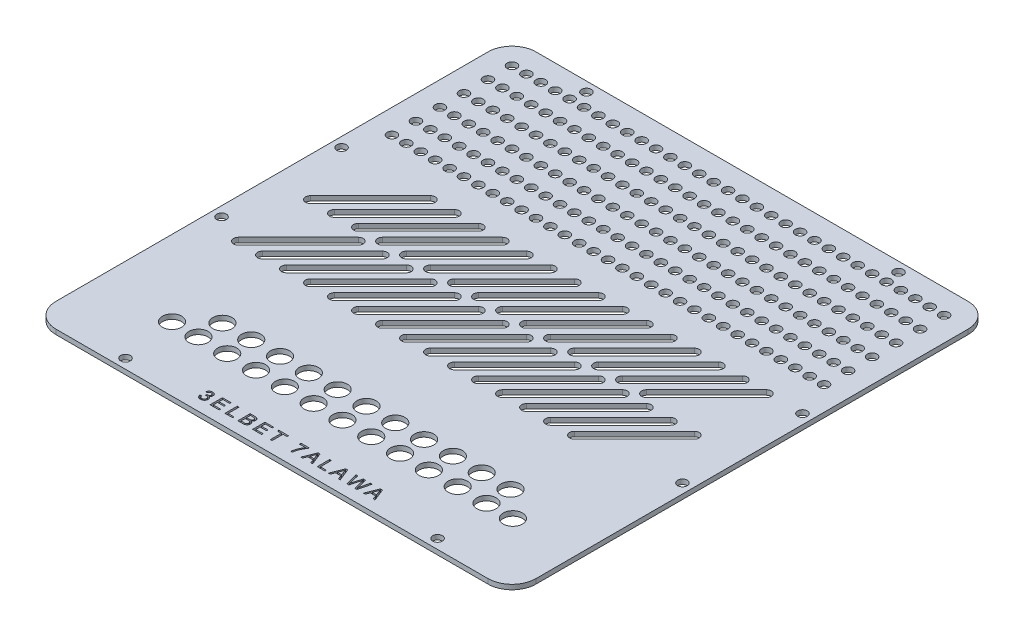
from build123d import *

# Parameters (mm, degrees)
SKETCH2_R             = 2
SKETCH2_R_2           = 4
BOSS_EXTRUDE2_DEPTH   = 2
BOSS_EXTRUDE2_2_DEPTH = 2
BOSS_EXTRUDE2_3_DEPTH = 2
BOSS_EXTRUDE2_4_DEPTH = 2
BOSS_EXTRUDE2_5_DEPTH = 2
BOSS_EXTRUDE2_6_DEPTH = 2


with BuildPart() as part:
    # Sketch2 → Boss-Extrude2 (new body)
    with BuildSketch(Plane(origin=(0, 0, 0), x_dir=(1, 0, 0), z_dir=(0, 1, 0))):
        with BuildLine():
            Line((-90, -100), (90, -100))
            ThreePointArc((90, -100), (97.071067812, -97.071067812), (100, -90))
            Line((100, -90), (100, 90))
            ThreePointArc((100, 90), (97.071067812, 97.071067812), (90, 100))
            Line((90, 100), (-90, 100))
            ThreePointArc((-90, 100), (-97.071067812, 97.071067812), (-100, 90))
            Line((-100, 90), (-100, -90))
            ThreePointArc((-100, -90), (-97.071067812, -97.071067812), (-90, -100))
        make_face()
        with Locations((-65, 96)):
            Circle(SKETCH2_R, mode=Mode.SUBTRACT)
        with Locations((65, 96)):
            Circle(SKETCH2_R, mode=Mode.SUBTRACT)
        with Locations((96, 25)):
            Circle(SKETCH2_R, mode=Mode.SUBTRACT)
        with Locations((96, -25)):
            Circle(SKETCH2_R, mode=Mode.SUBTRACT)
        with Locations((-96, 25)):
            Circle(SKETCH2_R, mode=Mode.SUBTRACT)
        with Locations((-96, -25)):
            Circle(SKETCH2_R, mode=Mode.SUBTRACT)
        with Locations((-65, -96)):
            Circle(SKETCH2_R, mode=Mode.SUBTRACT)
        with Locations((65, -96)):
            Circle(SKETCH2_R, mode=Mode.SUBTRACT)
        with Locations((-90, 90)):
            Circle(SKETCH2_R, mode=Mode.SUBTRACT)
        with Locations((-84, 90)):
            Circle(SKETCH2_R, mode=Mode.SUBTRACT)
        with Locations((-78, 90)):
            Circle(SKETCH2_R, mode=Mode.SUBTRACT)
        with Locations((-72, 90)):
            Circle(SKETCH2_R, mode=Mode.SUBTRACT)
        with Locations((-66, 90)):
            Circle(SKETCH2_R, mode=Mode.SUBTRACT)
        with Locations((-60, 90)):
            Circle(SKETCH2_R, mode=Mode.SUBTRACT)
        with Locations((-54, 90)):
            Circle(SKETCH2_R, mode=Mode.SUBTRACT)
        with Locations((-48, 90)):
            Circle(SKETCH2_R, mode=Mode.SUBTRACT)
        with Locations((-42, 90)):
            Circle(SKETCH2_R, mode=Mode.SUBTRACT)
        with Locations((-36, 90)):
            Circle(SKETCH2_R, mode=Mode.SUBTRACT)
        with Locations((-30, 90)):
            Circle(SKETCH2_R, mode=Mode.SUBTRACT)
        with Locations((-24, 90)):
            Circle(SKETCH2_R, mode=Mode.SUBTRACT)
        with Locations((-18, 90)):
            Circle(SKETCH2_R, mode=Mode.SUBTRACT)
        with Locations((-12, 90)):
            Circle(SKETCH2_R, mode=Mode.SUBTRACT)
        with Locations((-6, 90)):
            Circle(SKETCH2_R, mode=Mode.SUBTRACT)
        with Locations((0, 90)):
            Circle(SKETCH2_R, mode=Mode.SUBTRACT)
        with Locations((6, 90)):
            Circle(SKETCH2_R, mode=Mode.SUBTRACT)
        with Locations((12, 90)):
            Circle(SKETCH2_R, mode=Mode.SUBTRACT)
        with Locations((18, 90)):
            Circle(SKETCH2_R, mode=Mode.SUBTRACT)
        with Locations((24, 90)):
            Circle(SKETCH2_R, mode=Mode.SUBTRACT)
        with Locations((30, 90)):
            Circle(SKETCH2_R, mode=Mode.SUBTRACT)
        with Locations((36, 90)):
            Circle(SKETCH2_R, mode=Mode.SUBTRACT)
        with Locations((42, 90)):
            Circle(SKETCH2_R, mode=Mode.SUBTRACT)
        with Locations((48, 90)):
            Circle(SKETCH2_R, mode=Mode.SUBTRACT)
        with Locations((54, 90)):
            Circle(SKETCH2_R, mode=Mode.SUBTRACT)
        with Locations((60, 90)):
            Circle(SKETCH2_R, mode=Mode.SUBTRACT)
        with Locations((66, 90)):
            Circle(SKETCH2_R, mode=Mode.SUBTRACT)
        with Locations((72, 90)):
            Circle(SKETCH2_R, mode=Mode.SUBTRACT)
        with Locations((78, 90)):
            Circle(SKETCH2_R, mode=Mode.SUBTRACT)
        with Locations((84, 90)):
            Circle(SKETCH2_R, mode=Mode.SUBTRACT)
        with Locations((90, 90)):
            Circle(SKETCH2_R, mode=Mode.SUBTRACT)
        with Locations((-84, 80)):
            Circle(SKETCH2_R, mode=Mode.SUBTRACT)
        with Locations((-78, 80)):
            Circle(SKETCH2_R, mode=Mode.SUBTRACT)
        with Locations((-72, 80)):
            Circle(SKETCH2_R, mode=Mode.SUBTRACT)
        with Locations((-66, 80)):
            Circle(SKETCH2_R, mode=Mode.SUBTRACT)
        with Locations((-60, 80)):
            Circle(SKETCH2_R, mode=Mode.SUBTRACT)
        with Locations((-54, 80)):
            Circle(SKETCH2_R, mode=Mode.SUBTRACT)
        with Locations((-48, 80)):
            Circle(SKETCH2_R, mode=Mode.SUBTRACT)
        with Locations((-42, 80)):
            Circle(SKETCH2_R, mode=Mode.SUBTRACT)
        with Locations((-36, 80)):
            Circle(SKETCH2_R, mode=Mode.SUBTRACT)
        with Locations((-30, 80)):
            Circle(SKETCH2_R, mode=Mode.SUBTRACT)
        with Locations((-24, 80)):
            Circle(SKETCH2_R, mode=Mode.SUBTRACT)
        with Locations((-18, 80)):
            Circle(SKETCH2_R, mode=Mode.SUBTRACT)
        with Locations((-12, 80)):
            Circle(SKETCH2_R, mode=Mode.SUBTRACT)
        with Locations((-6, 80)):
            Circle(SKETCH2_R, mode=Mode.SUBTRACT)
        with Locations((0, 80)):
            Circle(SKETCH2_R, mode=Mode.SUBTRACT)
        with Locations((6, 80)):
            Circle(SKETCH2_R, mode=Mode.SUBTRACT)
        with Locations((12, 80)):
            Circle(SKETCH2_R, mode=Mode.SUBTRACT)
        with Locations((18, 80)):
            Circle(SKETCH2_R, mode=Mode.SUBTRACT)
        with Locations((24, 80)):
            Circle(SKETCH2_R, mode=Mode.SUBTRACT)
        with Locations((30, 80)):
            Circle(SKETCH2_R, mode=Mode.SUBTRACT)
        with Locations((36, 80)):
            Circle(SKETCH2_R, mode=Mode.SUBTRACT)
        with Locations((42, 80)):
            Circle(SKETCH2_R, mode=Mode.SUBTRACT)
        with Locations((48, 80)):
            Circle(SKETCH2_R, mode=Mode.SUBTRACT)
        with Locations((54, 80)):
            Circle(SKETCH2_R, mode=Mode.SUBTRACT)
        with Locations((60, 80)):
            Circle(SKETCH2_R, mode=Mode.SUBTRACT)
        with Locations((66, 80)):
            Circle(SKETCH2_R, mode=Mode.SUBTRACT)
        with Locations((72, 80)):
            Circle(SKETCH2_R, mode=Mode.SUBTRACT)
        with Locations((78, 80)):
            Circle(SKETCH2_R, mode=Mode.SUBTRACT)
        with Locations((84, 80)):
            Circle(SKETCH2_R, mode=Mode.SUBTRACT)
        with Locations((90, 80)):
            Circle(SKETCH2_R, mode=Mode.SUBTRACT)
        with Locations((-84, 70)):
            Circle(SKETCH2_R, mode=Mode.SUBTRACT)
        with Locations((-78, 70)):
            Circle(SKETCH2_R, mode=Mode.SUBTRACT)
        with Locations((-72, 70)):
            Circle(SKETCH2_R, mode=Mode.SUBTRACT)
        with Locations((-66, 70)):
            Circle(SKETCH2_R, mode=Mode.SUBTRACT)
        with Locations((-60, 70)):
            Circle(SKETCH2_R, mode=Mode.SUBTRACT)
        with Locations((-54, 70)):
            Circle(SKETCH2_R, mode=Mode.SUBTRACT)
        with Locations((-48, 70)):
            Circle(SKETCH2_R, mode=Mode.SUBTRACT)
        with Locations((-42, 70)):
            Circle(SKETCH2_R, mode=Mode.SUBTRACT)
        with Locations((-36, 70)):
            Circle(SKETCH2_R, mode=Mode.SUBTRACT)
        with Locations((-30, 70)):
            Circle(SKETCH2_R, mode=Mode.SUBTRACT)
        with Locations((-24, 70)):
            Circle(SKETCH2_R, mode=Mode.SUBTRACT)
        with Locations((-18, 70)):
            Circle(SKETCH2_R, mode=Mode.SUBTRACT)
        with Locations((-12, 70)):
            Circle(SKETCH2_R, mode=Mode.SUBTRACT)
        with Locations((-6, 70)):
            Circle(SKETCH2_R, mode=Mode.SUBTRACT)
        with Locations((0, 70)):
            Circle(SKETCH2_R, mode=Mode.SUBTRACT)
        with Locations((6, 70)):
            Circle(SKETCH2_R, mode=Mode.SUBTRACT)
        with Locations((12, 70)):
            Circle(SKETCH2_R, mode=Mode.SUBTRACT)
        with Locations((18, 70)):
            Circle(SKETCH2_R, mode=Mode.SUBTRACT)
        with Locations((24, 70)):
            Circle(SKETCH2_R, mode=Mode.SUBTRACT)
        with Locations((30, 70)):
            Circle(SKETCH2_R, mode=Mode.SUBTRACT)
        with Locations((36, 70)):
            Circle(SKETCH2_R, mode=Mode.SUBTRACT)
        with Locations((42, 70)):
            Circle(SKETCH2_R, mode=Mode.SUBTRACT)
        with Locations((48, 70)):
            Circle(SKETCH2_R, mode=Mode.SUBTRACT)
        with Locations((54, 70)):
            Circle(SKETCH2_R, mode=Mode.SUBTRACT)
        with Locations((60, 70)):
            Circle(SKETCH2_R, mode=Mode.SUBTRACT)
        with Locations((66, 70)):
            Circle(SKETCH2_R, mode=Mode.SUBTRACT)
        with Locations((72, 70)):
            Circle(SKETCH2_R, mode=Mode.SUBTRACT)
        with Locations((78, 70)):
            Circle(SKETCH2_R, mode=Mode.SUBTRACT)
        with Locations((84, 70)):
            Circle(SKETCH2_R, mode=Mode.SUBTRACT)
        with Locations((90, 70)):
            Circle(SKETCH2_R, mode=Mode.SUBTRACT)
        with Locations((-84, 60)):
            Circle(SKETCH2_R, mode=Mode.SUBTRACT)
        with Locations((-78, 60)):
            Circle(SKETCH2_R, mode=Mode.SUBTRACT)
        with Locations((-72, 60)):
            Circle(SKETCH2_R, mode=Mode.SUBTRACT)
        with Locations((-66, 60)):
            Circle(SKETCH2_R, mode=Mode.SUBTRACT)
        with Locations((-60, 60)):
            Circle(SKETCH2_R, mode=Mode.SUBTRACT)
        with Locations((-54, 60)):
            Circle(SKETCH2_R, mode=Mode.SUBTRACT)
        with Locations((-48, 60)):
            Circle(SKETCH2_R, mode=Mode.SUBTRACT)
        with Locations((-42, 60)):
            Circle(SKETCH2_R, mode=Mode.SUBTRACT)
        with Locations((-36, 60)):
            Circle(SKETCH2_R, mode=Mode.SUBTRACT)
        with Locations((-30, 60)):
            Circle(SKETCH2_R, mode=Mode.SUBTRACT)
        with Locations((-24, 60)):
            Circle(SKETCH2_R, mode=Mode.SUBTRACT)
        with Locations((-18, 60)):
            Circle(SKETCH2_R, mode=Mode.SUBTRACT)
        with Locations((-12, 60)):
            Circle(SKETCH2_R, mode=Mode.SUBTRACT)
        with Locations((-6, 60)):
            Circle(SKETCH2_R, mode=Mode.SUBTRACT)
        with Locations((0, 60)):
            Circle(SKETCH2_R, mode=Mode.SUBTRACT)
        with Locations((6, 60)):
            Circle(SKETCH2_R, mode=Mode.SUBTRACT)
        with Locations((12, 60)):
            Circle(SKETCH2_R, mode=Mode.SUBTRACT)
        with Locations((18, 60)):
            Circle(SKETCH2_R, mode=Mode.SUBTRACT)
        with Locations((24, 60)):
            Circle(SKETCH2_R, mode=Mode.SUBTRACT)
        with Locations((30, 60)):
            Circle(SKETCH2_R, mode=Mode.SUBTRACT)
        with Locations((36, 60)):
            Circle(SKETCH2_R, mode=Mode.SUBTRACT)
        with Locations((42, 60)):
            Circle(SKETCH2_R, mode=Mode.SUBTRACT)
        with Locations((48, 60)):
            Circle(SKETCH2_R, mode=Mode.SUBTRACT)
        with Locations((54, 60)):
            Circle(SKETCH2_R, mode=Mode.SUBTRACT)
        with Locations((60, 60)):
            Circle(SKETCH2_R, mode=Mode.SUBTRACT)
        with Locations((66, 60)):
            Circle(SKETCH2_R, mode=Mode.SUBTRACT)
        with Locations((72, 60)):
            Circle(SKETCH2_R, mode=Mode.SUBTRACT)
        with Locations((78, 60)):
            Circle(SKETCH2_R, mode=Mode.SUBTRACT)
        with Locations((84, 60)):
            Circle(SKETCH2_R, mode=Mode.SUBTRACT)
        with Locations((90, 60)):
            Circle(SKETCH2_R, mode=Mode.SUBTRACT)
        with Locations((-84, 50)):
            Circle(SKETCH2_R, mode=Mode.SUBTRACT)
        with Locations((-78, 50)):
            Circle(SKETCH2_R, mode=Mode.SUBTRACT)
        with Locations((-72, 50)):
            Circle(SKETCH2_R, mode=Mode.SUBTRACT)
        with Locations((-66, 50)):
            Circle(SKETCH2_R, mode=Mode.SUBTRACT)
        with Locations((-60, 50)):
            Circle(SKETCH2_R, mode=Mode.SUBTRACT)
        with Locations((-54, 50)):
            Circle(SKETCH2_R, mode=Mode.SUBTRACT)
        with Locations((-48, 50)):
            Circle(SKETCH2_R, mode=Mode.SUBTRACT)
        with Locations((-42, 50)):
            Circle(SKETCH2_R, mode=Mode.SUBTRACT)
        with Locations((-36, 50)):
            Circle(SKETCH2_R, mode=Mode.SUBTRACT)
        with Locations((-30, 50)):
            Circle(SKETCH2_R, mode=Mode.SUBTRACT)
        with Locations((-24, 50)):
            Circle(SKETCH2_R, mode=Mode.SUBTRACT)
        with Locations((-18, 50)):
            Circle(SKETCH2_R, mode=Mode.SUBTRACT)
        with Locations((-12, 50)):
            Circle(SKETCH2_R, mode=Mode.SUBTRACT)
        with Locations((-6, 50)):
            Circle(SKETCH2_R, mode=Mode.SUBTRACT)
        with Locations((0, 50)):
            Circle(SKETCH2_R, mode=Mode.SUBTRACT)
        with Locations((6, 50)):
            Circle(SKETCH2_R, mode=Mode.SUBTRACT)
        with Locations((12, 50)):
            Circle(SKETCH2_R, mode=Mode.SUBTRACT)
        with Locations((18, 50)):
            Circle(SKETCH2_R, mode=Mode.SUBTRACT)
        with Locations((24, 50)):
            Circle(SKETCH2_R, mode=Mode.SUBTRACT)
        with Locations((30, 50)):
            Circle(SKETCH2_R, mode=Mode.SUBTRACT)
        with Locations((36, 50)):
            Circle(SKETCH2_R, mode=Mode.SUBTRACT)
        with Locations((42, 50)):
            Circle(SKETCH2_R, mode=Mode.SUBTRACT)
        with Locations((48, 50)):
            Circle(SKETCH2_R, mode=Mode.SUBTRACT)
        with Locations((54, 50)):
            Circle(SKETCH2_R, mode=Mode.SUBTRACT)
        with Locations((60, 50)):
            Circle(SKETCH2_R, mode=Mode.SUBTRACT)
        with Locations((66, 50)):
            Circle(SKETCH2_R, mode=Mode.SUBTRACT)
        with Locations((72, 50)):
            Circle(SKETCH2_R, mode=Mode.SUBTRACT)
        with Locations((78, 50)):
            Circle(SKETCH2_R, mode=Mode.SUBTRACT)
        with Locations((84, 50)):
            Circle(SKETCH2_R, mode=Mode.SUBTRACT)
        with Locations((90, 50)):
            Circle(SKETCH2_R, mode=Mode.SUBTRACT)
        with Locations((-84, 40)):
            Circle(SKETCH2_R, mode=Mode.SUBTRACT)
        with Locations((-78, 40)):
            Circle(SKETCH2_R, mode=Mode.SUBTRACT)
        with Locations((-72, 40)):
            Circle(SKETCH2_R, mode=Mode.SUBTRACT)
        with Locations((-66, 40)):
            Circle(SKETCH2_R, mode=Mode.SUBTRACT)
        with Locations((-60, 40)):
            Circle(SKETCH2_R, mode=Mode.SUBTRACT)
        with Locations((-54, 40)):
            Circle(SKETCH2_R, mode=Mode.SUBTRACT)
        with Locations((-48, 40)):
            Circle(SKETCH2_R, mode=Mode.SUBTRACT)
        with Locations((-42, 40)):
            Circle(SKETCH2_R, mode=Mode.SUBTRACT)
        with Locations((-36, 40)):
            Circle(SKETCH2_R, mode=Mode.SUBTRACT)
        with Locations((-30, 40)):
            Circle(SKETCH2_R, mode=Mode.SUBTRACT)
        with Locations((-24, 40)):
            Circle(SKETCH2_R, mode=Mode.SUBTRACT)
        with Locations((-18, 40)):
            Circle(SKETCH2_R, mode=Mode.SUBTRACT)
        with Locations((-12, 40)):
            Circle(SKETCH2_R, mode=Mode.SUBTRACT)
        with Locations((-6, 40)):
            Circle(SKETCH2_R, mode=Mode.SUBTRACT)
        with Locations((0, 40)):
            Circle(SKETCH2_R, mode=Mode.SUBTRACT)
        with Locations((6, 40)):
            Circle(SKETCH2_R, mode=Mode.SUBTRACT)
        with Locations((12, 40)):
            Circle(SKETCH2_R, mode=Mode.SUBTRACT)
        with Locations((18, 40)):
            Circle(SKETCH2_R, mode=Mode.SUBTRACT)
        with Locations((24, 40)):
            Circle(SKETCH2_R, mode=Mode.SUBTRACT)
        with Locations((30, 40)):
            Circle(SKETCH2_R, mode=Mode.SUBTRACT)
        with Locations((36, 40)):
            Circle(SKETCH2_R, mode=Mode.SUBTRACT)
        with Locations((42, 40)):
            Circle(SKETCH2_R, mode=Mode.SUBTRACT)
        with Locations((48, 40)):
            Circle(SKETCH2_R, mode=Mode.SUBTRACT)
        with Locations((54, 40)):
            Circle(SKETCH2_R, mode=Mode.SUBTRACT)
        with Locations((60, 40)):
            Circle(SKETCH2_R, mode=Mode.SUBTRACT)
        with Locations((66, 40)):
            Circle(SKETCH2_R, mode=Mode.SUBTRACT)
        with Locations((72, 40)):
            Circle(SKETCH2_R, mode=Mode.SUBTRACT)
        with Locations((78, 40)):
            Circle(SKETCH2_R, mode=Mode.SUBTRACT)
        with Locations((84, 40)):
            Circle(SKETCH2_R, mode=Mode.SUBTRACT)
        with Locations((90, 40)):
            Circle(SKETCH2_R, mode=Mode.SUBTRACT)
        with Locations((-57.48128573, -63.13813998)):
            Circle(SKETCH2_R_2, mode=Mode.SUBTRACT)
        with Locations((-45.48128573, -63.13813998)):
            Circle(SKETCH2_R_2, mode=Mode.SUBTRACT)
        with Locations((-33.48128573, -63.13813998)):
            Circle(SKETCH2_R_2, mode=Mode.SUBTRACT)
        with Locations((-21.48128573, -63.13813998)):
            Circle(SKETCH2_R_2, mode=Mode.SUBTRACT)
        with Locations((-9.48128573, -63.13813998)):
            Circle(SKETCH2_R_2, mode=Mode.SUBTRACT)
        with Locations((2.51871427, -63.13813998)):
            Circle(SKETCH2_R_2, mode=Mode.SUBTRACT)
        with Locations((14.51871427, -63.13813998)):
            Circle(SKETCH2_R_2, mode=Mode.SUBTRACT)
        with Locations((26.51871427, -63.13813998)):
            Circle(SKETCH2_R_2, mode=Mode.SUBTRACT)
        with Locations((38.51871427, -63.13813998)):
            Circle(SKETCH2_R_2, mode=Mode.SUBTRACT)
        with Locations((50.51871427, -63.13813998)):
            Circle(SKETCH2_R_2, mode=Mode.SUBTRACT)
        with Locations((62.51871427, -63.13813998)):
            Circle(SKETCH2_R_2, mode=Mode.SUBTRACT)
        with Locations((-45.48128573, -73.13813998)):
            Circle(SKETCH2_R_2, mode=Mode.SUBTRACT)
        with Locations((-33.48128573, -73.13813998)):
            Circle(SKETCH2_R_2, mode=Mode.SUBTRACT)
        with Locations((-21.48128573, -73.13813998)):
            Circle(SKETCH2_R_2, mode=Mode.SUBTRACT)
        with Locations((-9.48128573, -73.13813998)):
            Circle(SKETCH2_R_2, mode=Mode.SUBTRACT)
        with Locations((2.51871427, -73.13813998)):
            Circle(SKETCH2_R_2, mode=Mode.SUBTRACT)
        with Locations((14.51871427, -73.13813998)):
            Circle(SKETCH2_R_2, mode=Mode.SUBTRACT)
        with Locations((26.51871427, -73.13813998)):
            Circle(SKETCH2_R_2, mode=Mode.SUBTRACT)
        with Locations((38.51871427, -73.13813998)):
            Circle(SKETCH2_R_2, mode=Mode.SUBTRACT)
        with Locations((50.51871427, -73.13813998)):
            Circle(SKETCH2_R_2, mode=Mode.SUBTRACT)
        with Locations((62.51871427, -73.13813998)):
            Circle(SKETCH2_R_2, mode=Mode.SUBTRACT)
        with Locations((-57.48128573, -73.13813998)):
            Circle(SKETCH2_R_2, mode=Mode.SUBTRACT)
        with Locations((-68.48128573, -73.13813998)):
            Circle(SKETCH2_R_2, mode=Mode.SUBTRACT)
        with Locations((73.51871427, -73.13813998)):
            Circle(SKETCH2_R_2, mode=Mode.SUBTRACT)
        with Locations((-90, 80)):
            Circle(SKETCH2_R, mode=Mode.SUBTRACT)
        with Locations((-90, 70)):
            Circle(SKETCH2_R, mode=Mode.SUBTRACT)
        with Locations((-90, 60)):
            Circle(SKETCH2_R, mode=Mode.SUBTRACT)
        with Locations((-90, 50)):
            Circle(SKETCH2_R, mode=Mode.SUBTRACT)
        with Locations((-90, 40)):
            Circle(SKETCH2_R, mode=Mode.SUBTRACT)
        with BuildLine():
            Line((-85.134521289, 1.134521289), (-60.134521289, 26.134521289))
            ThreePointArc((-60.134521289, 26.134521289), (-57.306094164, 26.134521289), (-57.306094164, 23.306094164))
            Line((-57.306094164, 23.306094164), (-82.306094164, -1.693905836))
            ThreePointArc((-82.306094164, -1.693905836), (-85.134521289, -1.693905836), (-85.134521289, 1.134521289))
        make_face(mode=Mode.SUBTRACT)
        with BuildLine():
            Line((-75.134521289, 1.134521289), (-50.134521289, 26.134521289))
            ThreePointArc((-50.134521289, 26.134521289), (-47.306094164, 26.134521289), (-47.306094164, 23.306094164))
            Line((-47.306094164, 23.306094164), (-72.306094164, -1.693905836))
            ThreePointArc((-72.306094164, -1.693905836), (-75.134521289, -1.693905836), (-75.134521289, 1.134521289))
        make_face(mode=Mode.SUBTRACT)
        with BuildLine():
            Line((-65.134521289, 1.134521289), (-40.134521289, 26.134521289))
            ThreePointArc((-40.134521289, 26.134521289), (-37.306094164, 26.134521289), (-37.306094164, 23.306094164))
            Line((-37.306094164, 23.306094164), (-62.306094164, -1.693905836))
            ThreePointArc((-62.306094164, -1.693905836), (-65.134521289, -1.693905836), (-65.134521289, 1.134521289))
        make_face(mode=Mode.SUBTRACT)
        with BuildLine():
            Line((-55.134521289, 1.134521289), (-30.134521289, 26.134521289))
            ThreePointArc((-30.134521289, 26.134521289), (-27.306094164, 26.134521289), (-27.306094164, 23.306094164))
            Line((-27.306094164, 23.306094164), (-52.306094164, -1.693905836))
            ThreePointArc((-52.306094164, -1.693905836), (-55.134521289, -1.693905836), (-55.134521289, 1.134521289))
        make_face(mode=Mode.SUBTRACT)
        with BuildLine():
            Line((-45.134521289, 1.134521289), (-20.134521289, 26.134521289))
            ThreePointArc((-20.134521289, 26.134521289), (-17.306094164, 26.134521289), (-17.306094164, 23.306094164))
            Line((-17.306094164, 23.306094164), (-42.306094164, -1.693905836))
            ThreePointArc((-42.306094164, -1.693905836), (-45.134521289, -1.693905836), (-45.134521289, 1.134521289))
        make_face(mode=Mode.SUBTRACT)
        with BuildLine():
            Line((-35.134521289, 1.134521289), (-10.134521289, 26.134521289))
            ThreePointArc((-10.134521289, 26.134521289), (-7.306094164, 26.134521289), (-7.306094164, 23.306094164))
            Line((-7.306094164, 23.306094164), (-32.306094164, -1.693905836))
            ThreePointArc((-32.306094164, -1.693905836), (-35.134521289, -1.693905836), (-35.134521289, 1.134521289))
        make_face(mode=Mode.SUBTRACT)
        with BuildLine():
            Line((-25.134521289, 1.134521289), (-0.134521289, 26.134521289))
            ThreePointArc((-0.134521289, 26.134521289), (2.693905836, 26.134521289), (2.693905836, 23.306094164))
            Line((2.693905836, 23.306094164), (-22.306094164, -1.693905836))
            ThreePointArc((-22.306094164, -1.693905836), (-25.134521289, -1.693905836), (-25.134521289, 1.134521289))
        make_face(mode=Mode.SUBTRACT)
        with BuildLine():
            Line((-15.134521289, 1.134521289), (9.865478711, 26.134521289))
            ThreePointArc((9.865478711, 26.134521289), (12.693905836, 26.134521289), (12.693905836, 23.306094164))
            Line((12.693905836, 23.306094164), (-12.306094164, -1.693905836))
            ThreePointArc((-12.306094164, -1.693905836), (-15.134521289, -1.693905836), (-15.134521289, 1.134521289))
        make_face(mode=Mode.SUBTRACT)
        with BuildLine():
            Line((-5.134521289, 1.134521289), (19.865478711, 26.134521289))
            ThreePointArc((19.865478711, 26.134521289), (22.693905836, 26.134521289), (22.693905836, 23.306094164))
            Line((22.693905836, 23.306094164), (-2.306094164, -1.693905836))
            ThreePointArc((-2.306094164, -1.693905836), (-5.134521289, -1.693905836), (-5.134521289, 1.134521289))
        make_face(mode=Mode.SUBTRACT)
        with BuildLine():
            Line((4.865478711, 1.134521289), (29.865478711, 26.134521289))
            ThreePointArc((29.865478711, 26.134521289), (32.693905836, 26.134521289), (32.693905836, 23.306094164))
            Line((32.693905836, 23.306094164), (7.693905836, -1.693905836))
            ThreePointArc((7.693905836, -1.693905836), (4.865478711, -1.693905836), (4.865478711, 1.134521289))
        make_face(mode=Mode.SUBTRACT)
        with BuildLine():
            Line((14.865478711, 1.134521289), (39.865478711, 26.134521289))
            ThreePointArc((39.865478711, 26.134521289), (42.693905836, 26.134521289), (42.693905836, 23.306094164))
            Line((42.693905836, 23.306094164), (17.693905836, -1.693905836))
            ThreePointArc((17.693905836, -1.693905836), (14.865478711, -1.693905836), (14.865478711, 1.134521289))
        make_face(mode=Mode.SUBTRACT)
        with BuildLine():
            Line((24.865478711, 1.134521289), (49.865478711, 26.134521289))
            ThreePointArc((49.865478711, 26.134521289), (52.693905836, 26.134521289), (52.693905836, 23.306094164))
            Line((52.693905836, 23.306094164), (27.693905836, -1.693905836))
            ThreePointArc((27.693905836, -1.693905836), (24.865478711, -1.693905836), (24.865478711, 1.134521289))
        make_face(mode=Mode.SUBTRACT)
        with BuildLine():
            Line((34.865478711, 1.134521289), (59.865478711, 26.134521289))
            ThreePointArc((59.865478711, 26.134521289), (62.693905836, 26.134521289), (62.693905836, 23.306094164))
            Line((62.693905836, 23.306094164), (37.693905836, -1.693905836))
            ThreePointArc((37.693905836, -1.693905836), (34.865478711, -1.693905836), (34.865478711, 1.134521289))
        make_face(mode=Mode.SUBTRACT)
        with BuildLine():
            Line((44.865478711, 1.134521289), (69.865478711, 26.134521289))
            ThreePointArc((69.865478711, 26.134521289), (72.693905836, 26.134521289), (72.693905836, 23.306094164))
            Line((72.693905836, 23.306094164), (47.693905836, -1.693905836))
            ThreePointArc((47.693905836, -1.693905836), (44.865478711, -1.693905836), (44.865478711, 1.134521289))
        make_face(mode=Mode.SUBTRACT)
        with BuildLine():
            Line((54.865478711, 1.134521289), (79.865478711, 26.134521289))
            ThreePointArc((79.865478711, 26.134521289), (82.693905836, 26.134521289), (82.693905836, 23.306094164))
            Line((82.693905836, 23.306094164), (57.693905836, -1.693905836))
            ThreePointArc((57.693905836, -1.693905836), (54.865478711, -1.693905836), (54.865478711, 1.134521289))
        make_face(mode=Mode.SUBTRACT)
        with BuildLine():
            Line((-75.134521289, -28.865478711), (-50.134521289, -3.865478711))
            ThreePointArc((-50.134521289, -3.865478711), (-47.306094164, -3.865478711), (-47.306094164, -6.693905836))
            Line((-47.306094164, -6.693905836), (-72.306094164, -31.693905836))
            ThreePointArc((-72.306094164, -31.693905836), (-75.134521289, -31.693905836), (-75.134521289, -28.865478711))
        make_face(mode=Mode.SUBTRACT)
        with BuildLine():
            Line((-65.134521289, -28.865478711), (-40.134521289, -3.865478711))
            ThreePointArc((-40.134521289, -3.865478711), (-37.306094164, -3.865478711), (-37.306094164, -6.693905836))
            Line((-37.306094164, -6.693905836), (-62.306094164, -31.693905836))
            ThreePointArc((-62.306094164, -31.693905836), (-65.134521289, -31.693905836), (-65.134521289, -28.865478711))
        make_face(mode=Mode.SUBTRACT)
        with BuildLine():
            Line((-55.134521289, -28.865478711), (-30.134521289, -3.865478711))
            ThreePointArc((-30.134521289, -3.865478711), (-27.306094164, -3.865478711), (-27.306094164, -6.693905836))
            Line((-27.306094164, -6.693905836), (-52.306094164, -31.693905836))
            ThreePointArc((-52.306094164, -31.693905836), (-55.134521289, -31.693905836), (-55.134521289, -28.865478711))
        make_face(mode=Mode.SUBTRACT)
        with BuildLine():
            Line((-45.134521289, -28.865478711), (-20.134521289, -3.865478711))
            ThreePointArc((-20.134521289, -3.865478711), (-17.306094164, -3.865478711), (-17.306094164, -6.693905836))
            Line((-17.306094164, -6.693905836), (-42.306094164, -31.693905836))
            ThreePointArc((-42.306094164, -31.693905836), (-45.134521289, -31.693905836), (-45.134521289, -28.865478711))
        make_face(mode=Mode.SUBTRACT)
        with BuildLine():
            Line((-35.134521289, -28.865478711), (-10.134521289, -3.865478711))
            ThreePointArc((-10.134521289, -3.865478711), (-7.306094164, -3.865478711), (-7.306094164, -6.693905836))
            Line((-7.306094164, -6.693905836), (-32.306094164, -31.693905836))
            ThreePointArc((-32.306094164, -31.693905836), (-35.134521289, -31.693905836), (-35.134521289, -28.865478711))
        make_face(mode=Mode.SUBTRACT)
        with BuildLine():
            Line((-25.134521289, -28.865478711), (-0.134521289, -3.865478711))
            ThreePointArc((-0.134521289, -3.865478711), (2.693905836, -3.865478711), (2.693905836, -6.693905836))
            Line((2.693905836, -6.693905836), (-22.306094164, -31.693905836))
            ThreePointArc((-22.306094164, -31.693905836), (-25.134521289, -31.693905836), (-25.134521289, -28.865478711))
        make_face(mode=Mode.SUBTRACT)
        with BuildLine():
            Line((-15.134521289, -28.865478711), (9.865478711, -3.865478711))
            ThreePointArc((9.865478711, -3.865478711), (12.693905836, -3.865478711), (12.693905836, -6.693905836))
            Line((12.693905836, -6.693905836), (-12.306094164, -31.693905836))
            ThreePointArc((-12.306094164, -31.693905836), (-15.134521289, -31.693905836), (-15.134521289, -28.865478711))
        make_face(mode=Mode.SUBTRACT)
        with BuildLine():
            Line((-5.134521289, -28.865478711), (19.865478711, -3.865478711))
            ThreePointArc((19.865478711, -3.865478711), (22.693905836, -3.865478711), (22.693905836, -6.693905836))
            Line((22.693905836, -6.693905836), (-2.306094164, -31.693905836))
            ThreePointArc((-2.306094164, -31.693905836), (-5.134521289, -31.693905836), (-5.134521289, -28.865478711))
        make_face(mode=Mode.SUBTRACT)
        with BuildLine():
            Line((4.865478711, -28.865478711), (29.865478711, -3.865478711))
            ThreePointArc((29.865478711, -3.865478711), (32.693905836, -3.865478711), (32.693905836, -6.693905836))
            Line((32.693905836, -6.693905836), (7.693905836, -31.693905836))
            ThreePointArc((7.693905836, -31.693905836), (4.865478711, -31.693905836), (4.865478711, -28.865478711))
        make_face(mode=Mode.SUBTRACT)
        with BuildLine():
            Line((14.865478711, -28.865478711), (39.865478711, -3.865478711))
            ThreePointArc((39.865478711, -3.865478711), (42.693905836, -3.865478711), (42.693905836, -6.693905836))
            Line((42.693905836, -6.693905836), (17.693905836, -31.693905836))
            ThreePointArc((17.693905836, -31.693905836), (14.865478711, -31.693905836), (14.865478711, -28.865478711))
        make_face(mode=Mode.SUBTRACT)
        with BuildLine():
            Line((24.865478711, -28.865478711), (49.865478711, -3.865478711))
            ThreePointArc((49.865478711, -3.865478711), (52.693905836, -3.865478711), (52.693905836, -6.693905836))
            Line((52.693905836, -6.693905836), (27.693905836, -31.693905836))
            ThreePointArc((27.693905836, -31.693905836), (24.865478711, -31.693905836), (24.865478711, -28.865478711))
        make_face(mode=Mode.SUBTRACT)
        with BuildLine():
            Line((34.865478711, -28.865478711), (59.865478711, -3.865478711))
            ThreePointArc((59.865478711, -3.865478711), (62.693905836, -3.865478711), (62.693905836, -6.693905836))
            Line((62.693905836, -6.693905836), (37.693905836, -31.693905836))
            ThreePointArc((37.693905836, -31.693905836), (34.865478711, -31.693905836), (34.865478711, -28.865478711))
        make_face(mode=Mode.SUBTRACT)
        with BuildLine():
            Line((44.865478711, -28.865478711), (69.865478711, -3.865478711))
            ThreePointArc((69.865478711, -3.865478711), (72.693905836, -3.865478711), (72.693905836, -6.693905836))
            Line((72.693905836, -6.693905836), (47.693905836, -31.693905836))
            ThreePointArc((47.693905836, -31.693905836), (44.865478711, -31.693905836), (44.865478711, -28.865478711))
        make_face(mode=Mode.SUBTRACT)
        with BuildLine():
            Line((54.865478711, -28.865478711), (79.865478711, -3.865478711))
            ThreePointArc((79.865478711, -3.865478711), (82.693905836, -3.865478711), (82.693905836, -6.693905836))
            Line((82.693905836, -6.693905836), (57.693905836, -31.693905836))
            ThreePointArc((57.693905836, -31.693905836), (54.865478711, -31.693905836), (54.865478711, -28.865478711))
        make_face(mode=Mode.SUBTRACT)
        with BuildLine():
            Line((-85.134521289, -28.865478711), (-60.134521289, -3.865478711))
            ThreePointArc((-60.134521289, -3.865478711), (-57.306094164, -3.865478711), (-57.306094164, -6.693905836))
            Line((-57.306094164, -6.693905836), (-82.306094164, -31.693905836))
            ThreePointArc((-82.306094164, -31.693905836), (-85.134521289, -31.693905836), (-85.134521289, -28.865478711))
        make_face(mode=Mode.SUBTRACT)
        with BuildLine():
            Line((-36.211282626, -93.791482426), (-35.552739374, -93.725628101))
            add(Edge.make_bspline(
                [(-35.552739374, -93.725628101), (-35.543960204, -93.765197279), (-35.52697316, -93.841760705), (-35.494288014, -93.951445767), (-35.459765323, -94.05325803), (-35.416967743, -94.144920201), (-35.375206608, -94.230180881), (-35.326130949, -94.305517179), (-35.273692656, -94.372894721), (-35.216922319, -94.432063318), (-35.155165762, -94.483014705), (-35.089246338, -94.527599917), (-35.01776991, -94.564834572), (-34.94128372, -94.594315344), (-34.860431965, -94.61818028), (-34.774775257, -94.635703869), (-34.683860657, -94.64614289), (-34.621546078, -94.647098869), (-34.589619867, -94.647588654)],
                knots=[0, 0, 0, 0, 1.321063709, 2.556160278, 3.730472002, 4.821700466, 5.852032229, 6.822994757, 7.746964065, 8.632786469, 9.490489437, 10.352773447, 11.223141997, 12.11199479, 13.021433979, 13.96892724, 14.959401504, 16, 16, 16, 16], degree=3))
            add(Edge.make_bspline(
                [(-34.589619867, -94.647588654), (-34.552171555, -94.647054732), (-34.479034939, -94.646011982), (-34.372462825, -94.630366733), (-34.271040665, -94.608884317), (-34.176215485, -94.575198659), (-34.086666897, -94.534028558), (-34.002905061, -94.483151047), (-33.924356636, -94.423408116), (-33.852570929, -94.35439339), (-33.788373151, -94.278474992), (-33.731196009, -94.198285787), (-33.683918195, -94.113141546), (-33.644070116, -94.02424155), (-33.614657023, -93.930149217), (-33.593124265, -93.832037832), (-33.579052496, -93.729463693), (-33.577766131, -93.659477915), (-33.577109616, -93.623759691)],
                knots=[0, 0, 0, 0, 1.111377895, 2.170522867, 3.193923215, 4.186422864, 5.152846954, 6.117443035, 7.091571248, 8.078879332, 9.069127402, 10.041602243, 10.999610288, 11.957618333, 12.930786866, 13.922135183, 14.939532534, 16, 16, 16, 16], degree=3))
            add(Edge.make_bspline(
                [(-33.577109616, -93.623759691), (-33.577881214, -93.589768346), (-33.579390783, -93.52326699), (-33.591800664, -93.425657268), (-33.613455633, -93.332999313), (-33.643474595, -93.244756881), (-33.681832668, -93.161059519), (-33.727937942, -93.081215128), (-33.784328472, -93.0069735), (-33.847800985, -92.937537217), (-33.91703098, -92.873566477), (-33.992792576, -92.81915113), (-34.072522248, -92.772188911), (-34.157170192, -92.734268757), (-34.246384945, -92.704171313), (-34.34008146, -92.682539689), (-34.438710208, -92.670124423), (-34.505894887, -92.66861459), (-34.540229123, -92.667843001)],
                knots=[0, 0, 0, 0, 1.072815875, 2.098878726, 3.09954706, 4.07199174, 5.036203424, 6.001873089, 6.97636515, 7.972747947, 8.969130744, 9.945905975, 10.911575641, 11.885646534, 12.868345115, 13.879560892, 14.916365174, 16, 16, 16, 16], degree=3))
            add(Edge.make_bspline(
                [(-34.540229123, -92.667843001), (-34.570458333, -92.668643868), (-34.634611763, -92.670343495), (-34.735867345, -92.685350552), (-34.848025052, -92.706363952), (-34.925529229, -92.726985488), (-34.96622429, -92.737813222)],
                knots=[0, 0, 0, 0, 0.837610211, 1.777604146, 2.833088267, 4, 4, 4, 4], degree=3))
            Line((-34.96622429, -92.737813222), (-34.898312017, -92.145124295))
            add(Edge.make_bspline(
                [(-34.898312017, -92.145124295), (-34.880493425, -92.14707138), (-34.849014106, -92.150511209), (-34.81737604, -92.151777565), (-34.803646424, -92.152327111)],
                knots=[0, 0, 0, 0, 1.132082448, 2, 2, 2, 2], degree=3))
            add(Edge.make_bspline(
                [(-34.803646424, -92.152327111), (-34.743082253, -92.150014795), (-34.624274386, -92.145478756), (-34.451075547, -92.107788075), (-34.286933846, -92.048445314), (-34.160123779, -91.97764079), (-34.066085717, -91.911045289), (-34.006787207, -91.850999999), (-33.95332654, -91.787279816), (-33.913440514, -91.714190459), (-33.878981448, -91.636531252), (-33.857642748, -91.551242991), (-33.842080824, -91.460398815), (-33.841054186, -91.39747767), (-33.840526917, -91.36516213)],
                knots=[0, 0, 0, 0, 1.557468908, 3.055264441, 4.54122591, 6.035034992, 6.780215604, 7.498173296, 8.201377046, 8.913174237, 9.633083494, 10.382644491, 11.169345745, 12, 12, 12, 12], degree=3))
            add(Edge.make_bspline(
                [(-33.840526917, -91.36516213), (-33.841013548, -91.339059779), (-33.84196526, -91.288010943), (-33.852567761, -91.21316796), (-33.870102996, -91.142251929), (-33.89380361, -91.074505661), (-33.924865618, -91.010284205), (-33.963384947, -90.94966618), (-34.007394587, -90.8914219), (-34.05934641, -90.838561051), (-34.114982304, -90.788932563), (-34.176331085, -90.747135198), (-34.240473005, -90.710004384), (-34.309670207, -90.68194636), (-34.382214374, -90.658878091), (-34.458725622, -90.642712781), (-34.539231879, -90.631856692), (-34.594384453, -90.630941923), (-34.62254703, -90.630474814)],
                knots=[0, 0, 0, 0, 1.041493611, 2.036867705, 3.009952345, 3.954088258, 4.897230656, 5.850851638, 6.817653571, 7.805463921, 8.805067469, 9.788883576, 10.763797054, 11.758134544, 12.762883247, 13.799594994, 14.876406454, 16, 16, 16, 16], degree=3))
            add(Edge.make_bspline(
                [(-34.62254703, -90.630474814), (-34.677660482, -90.632623778), (-34.784092726, -90.636773747), (-34.936473449, -90.675169566), (-35.074557896, -90.737298997), (-35.176788964, -90.810159475), (-35.249382011, -90.879818213), (-35.298966907, -90.938862027), (-35.343317787, -91.004063616), (-35.382560349, -91.07539974), (-35.416164415, -91.153157286), (-35.446457548, -91.236372955), (-35.469907243, -91.326379029), (-35.481129845, -91.388744365), (-35.486885049, -91.420726717)],
                knots=[0, 0, 0, 0, 1.533565899, 2.961543033, 4.347411787, 5.731829577, 6.434842101, 7.147085226, 7.87612511, 8.629021686, 9.412189982, 10.234506416, 11.094615066, 12, 12, 12, 12], degree=3))
            Line((-35.486885049, -91.420726717), (-36.145428301, -91.354872392))
            add(Edge.make_bspline(
                [(-36.145428301, -91.354872392), (-36.135126719, -91.303953111), (-36.114919355, -91.204070933), (-36.073750373, -91.059813851), (-36.023545308, -90.924397531), (-35.963265691, -90.798442828), (-35.895759324, -90.680442364), (-35.817885832, -90.571795807), (-35.731470959, -90.471857237), (-35.636361212, -90.380931484), (-35.53384776, -90.299724615), (-35.424446935, -90.229673036), (-35.30905655, -90.170294228), (-35.18756857, -90.122424403), (-35.060079184, -90.083498982), (-34.92622569, -90.057710794), (-34.786613956, -90.040266385), (-34.691544056, -90.038622891), (-34.643126506, -90.037785886)],
                knots=[0, 0, 0, 0, 1.136581168, 2.229493434, 3.279335563, 4.293305329, 5.282068175, 6.250623624, 7.213783178, 8.169396253, 9.125981663, 10.071280146, 11.007896369, 11.961295906, 12.925420184, 13.920544621, 14.940967302, 16, 16, 16, 16], degree=3))
            add(Edge.make_bspline(
                [(-34.643126506, -90.037785886), (-34.576105092, -90.039959226), (-34.444319323, -90.044232714), (-34.250756739, -90.078173274), (-34.065615147, -90.13387041), (-33.890384367, -90.211076572), (-33.728079155, -90.305420466), (-33.58445242, -90.418485877), (-33.461424258, -90.548316798), (-33.361384217, -90.693493801), (-33.282166539, -90.848063926), (-33.223547838, -91.008514419), (-33.188522284, -91.174660577), (-33.184167637, -91.287141485), (-33.181983665, -91.343553679)],
                knots=[0, 0, 0, 0, 1.104647871, 2.172094857, 3.229560912, 4.285649672, 5.322588163, 6.317201348, 7.289435229, 8.260615662, 9.214246199, 10.146367077, 11.070353327, 12, 12, 12, 12], degree=3))
            add(Edge.make_bspline(
                [(-33.181983665, -91.343553679), (-33.184197776, -91.396879954), (-33.188569433, -91.502170128), (-33.222226028, -91.656123014), (-33.279098976, -91.801976062), (-33.355969849, -91.940241005), (-33.455652509, -92.06792775), (-33.577873161, -92.181708278), (-33.720676592, -92.282671298), (-33.827695686, -92.335221433), (-33.882714844, -92.362237773)],
                knots=[0, 0, 0, 0, 0.975609618, 1.926294443, 2.868398979, 3.832526731, 4.812148358, 5.820404151, 6.879456693, 8, 8, 8, 8], degree=3))
            add(Edge.make_bspline(
                [(-33.882714844, -92.362237773), (-33.84582817, -92.371550929), (-33.77357794, -92.389792682), (-33.669810225, -92.427589082), (-33.572256925, -92.471839155), (-33.479619665, -92.521957572), (-33.394587881, -92.581230723), (-33.314230601, -92.646039194), (-33.241585519, -92.719504207), (-33.174547973, -92.799007338), (-33.113552038, -92.883716573), (-33.062223361, -92.975279697), (-33.017928204, -93.071289678), (-32.980157506, -93.172442871), (-32.953015567, -93.279519246), (-32.933608223, -93.391689279), (-32.920800959, -93.508563255), (-32.91931853, -93.588397627), (-32.918566364, -93.62890456)],
                knots=[0, 0, 0, 0, 1.053251915, 2.063013066, 3.05373318, 4.018979697, 4.975584284, 5.920798056, 6.874756953, 7.832116109, 8.799604348, 9.761196922, 10.734637845, 11.72654167, 12.747371341, 13.789206138, 14.878271633, 16, 16, 16, 16], degree=3))
            add(Edge.make_bspline(
                [(-32.918566364, -93.62890456), (-32.919819744, -93.684206268), (-32.922283038, -93.79289187), (-32.945635147, -93.952553492), (-32.983797733, -94.105530792), (-33.036609633, -94.252343249), (-33.103530668, -94.393590033), (-33.187505529, -94.527277912), (-33.286045392, -94.654493586), (-33.397609724, -94.774019013), (-33.519839128, -94.883866558), (-33.652575583, -94.97898403), (-33.793192911, -95.059759286), (-33.941919942, -95.125631108), (-34.098362404, -95.177383583), (-34.262675927, -95.21448141), (-34.435368973, -95.236284185), (-34.553200031, -95.238928931), (-34.613286265, -95.240277582)],
                knots=[0, 0, 0, 0, 1.016055063, 1.996874249, 2.958724482, 3.910019225, 4.860394196, 5.826121543, 6.806008102, 7.814207964, 8.82789325, 9.821757317, 10.810247154, 11.803791187, 12.806673825, 13.834534493, 14.895752369, 16, 16, 16, 16], degree=3))
            add(Edge.make_bspline(
                [(-34.613286265, -95.240277582), (-34.667208674, -95.239261902), (-34.773363574, -95.237262375), (-34.928752429, -95.216430709), (-35.07762303, -95.186868184), (-35.218798192, -95.141293995), (-35.353917788, -95.085717011), (-35.480693384, -95.014614644), (-35.6014045, -94.932991882), (-35.71378494, -94.838516739), (-35.817210591, -94.734240878), (-35.909478643, -94.621706627), (-35.988709847, -94.501163845), (-36.058567684, -94.374416083), (-36.115030884, -94.239074082), (-36.158996424, -94.096299841), (-36.192520739, -93.946623236), (-36.204960617, -93.843758701), (-36.211282626, -93.791482426)],
                knots=[0, 0, 0, 0, 1.08471039, 2.135426191, 3.150939737, 4.135689946, 5.116584603, 6.086901885, 7.055842759, 8.045878862, 9.036901429, 10.008421467, 10.96965771, 11.936653536, 12.917548193, 13.915472582, 14.940632654, 16, 16, 16, 16], degree=3))
        make_face(mode=Mode.SUBTRACT)
        Polygon((-30.574152385, -95.174423256), (-30.574152385, -90.037785886), (-26.952164496, -90.037785886), (-26.952164496, -90.630474814), (-29.849754807, -90.630474814), (-29.849754807, -92.21097862), (-27.149727471, -92.21097862), (-27.149727471, -92.803667547), (-29.849754807, -92.803667547), (-29.849754807, -94.581734329), (-26.820455845, -94.581734329), (-26.820455845, -95.174423256), align=None, mode=Mode.SUBTRACT)
        Polygon((-24.410187541, -95.174423256), (-24.410187541, -90.037785886), (-23.685789963, -90.037785886), (-23.685789963, -94.581734329), (-21.249179929, -94.581734329), (-21.249179929, -95.174423256), align=None, mode=Mode.SUBTRACT)
        with BuildLine():
            Line((-19.0364746, -95.174423256), (-19.0364746, -90.037785886))
            Line((-19.0364746, -90.037785886), (-17.113322508, -90.037785886))
            add(Edge.make_bspline(
                [(-17.113322508, -90.037785886), (-17.065631517, -90.037968841), (-16.972572835, -90.038325836), (-16.836687918, -90.047253925), (-16.707994754, -90.059465699), (-16.586216297, -90.075207051), (-16.471879481, -90.098047432), (-16.365090856, -90.125717027), (-16.265294695, -90.157633011), (-16.143309096, -90.206251392), (-16.002734067, -90.281085416), (-15.852164856, -90.392749587), (-15.721163793, -90.526818201), (-15.613369183, -90.68053546), (-15.52455805, -90.844734482), (-15.461591997, -91.016287122), (-15.421334388, -91.191458259), (-15.416766693, -91.310071707), (-15.414486711, -91.369278025)],
                knots=[0, 0, 0, 0, 0.939712594, 1.833646414, 2.682508961, 3.487467313, 4.25240329, 4.978730417, 5.660668875, 6.315918528, 7.564895217, 8.787077865, 9.996481721, 11.241996224, 12.475862915, 13.665015424, 14.834484263, 16, 16, 16, 16], degree=3))
            add(Edge.make_bspline(
                [(-15.414486711, -91.369278025), (-15.416883453, -91.424361474), (-15.42165383, -91.533997316), (-15.459620691, -91.69549758), (-15.519544013, -91.85231333), (-15.604277287, -92.002538159), (-15.712577032, -92.143423739), (-15.846837789, -92.270203303), (-16.005130244, -92.383148553), (-16.123928726, -92.443351692), (-16.185188112, -92.474395921)],
                knots=[0, 0, 0, 0, 0.926741525, 1.844548388, 2.778836836, 3.746021974, 4.738420572, 5.759761325, 6.844803049, 8, 8, 8, 8], degree=3))
            add(Edge.make_bspline(
                [(-16.185188112, -92.474395921), (-16.14729265, -92.486258826), (-16.073099783, -92.509484374), (-15.96643983, -92.551983871), (-15.866318709, -92.600375631), (-15.772518483, -92.654739175), (-15.685672949, -92.715577936), (-15.606027153, -92.782986758), (-15.533028865, -92.855922508), (-15.466808503, -92.934340819), (-15.408640863, -93.017737054), (-15.356471757, -93.104288499), (-15.313392778, -93.195037425), (-15.278082508, -93.289748225), (-15.250535248, -93.387835668), (-15.230753317, -93.489677018), (-15.219478121, -93.595035217), (-15.217784623, -93.666607188), (-15.216923736, -93.702990676)],
                knots=[0, 0, 0, 0, 1.127427615, 2.20731145, 3.257257018, 4.283066884, 5.282973838, 6.264540225, 7.242620376, 8.210460609, 9.17525685, 10.12748095, 11.077310519, 12.023587065, 12.994999128, 13.967387486, 14.966724908, 16, 16, 16, 16], degree=3))
            add(Edge.make_bspline(
                [(-15.216923736, -93.702990676), (-15.218698155, -93.761403859), (-15.22221527, -93.877185893), (-15.250461626, -94.047597577), (-15.298196469, -94.211519255), (-15.363899421, -94.366300511), (-15.442187134, -94.50941857), (-15.531163862, -94.637126134), (-15.628560515, -94.748109102), (-15.737119683, -94.841465615), (-15.856141112, -94.920697975), (-15.988986471, -94.987416804), (-16.134628624, -95.046256417), (-16.296027667, -95.093259673), (-16.47311013, -95.130598997), (-16.668279186, -95.154858417), (-16.881834681, -95.17222491), (-17.0306214, -95.173669994), (-17.108177639, -95.174423256)],
                knots=[0, 0, 0, 0, 1.028073207, 2.037766189, 3.031549473, 4.027532207, 4.992436545, 5.898794514, 6.762903869, 7.584966804, 8.412380356, 9.273953678, 10.198004568, 11.174406109, 12.229717296, 13.381036288, 14.634844708, 16, 16, 16, 16], degree=3))
            Line((-17.108177639, -95.174423256), (-19.0364746, -95.174423256))
        make_face(mode=Mode.SUBTRACT)
        Polygon((-12.872509756, -95.174423256), (-12.872509756, -90.037785886), (-9.250521868, -90.037785886), (-9.250521868, -90.630474814), (-12.148112179, -90.630474814), (-12.148112179, -92.21097862), (-9.448084843, -92.21097862), (-9.448084843, -92.803667547), (-12.148112179, -92.803667547), (-12.148112179, -94.581734329), (-9.118813217, -94.581734329), (-9.118813217, -95.174423256), align=None, mode=Mode.SUBTRACT)
        Polygon((-5.457312733, -95.174423256), (-5.457312733, -90.630474814), (-7.103670864, -90.630474814), (-7.103670864, -90.037785886), (-3.086557024, -90.037785886), (-3.086557024, -90.630474814), (-4.732915155, -90.630474814), (-4.732915155, -95.174423256), align=None, mode=Mode.SUBTRACT)
        with BuildLine():
            Line((2.260814187, -90.762183464), (2.260814187, -90.103640212))
            Line((2.260814187, -90.103640212), (5.55353045, -90.103640212))
            Line((5.55353045, -90.103640212), (5.55353045, -90.636648657))
            add(Edge.make_bspline(
                [(5.55353045, -90.636648657), (5.514766586, -90.681979754), (5.435508101, -90.774665924), (5.320686001, -90.92230011), (5.205267263, -91.079480141), (5.09128061, -91.247717461), (4.977022854, -91.425784277), (4.862953843, -91.614249296), (4.748607908, -91.812653478), (4.598620272, -92.090458001), (4.419677286, -92.44611783), (4.233738533, -92.884354743), (4.068667894, -93.326959603), (3.980824792, -93.627973448), (3.937012559, -93.778105766)],
                knots=[0, 0, 0, 0, 0.603281671, 1.233499104, 1.891379699, 2.575603978, 3.288773649, 4.031381703, 4.80386477, 5.604951941, 7.224880277, 8.828980706, 10.418436603, 12, 12, 12, 12], degree=3))
            add(Edge.make_bspline(
                [(3.937012559, -93.778105766), (3.908598468, -93.886531446), (3.850793655, -94.107109542), (3.787515188, -94.449639395), (3.73859155, -94.806778359), (3.719380139, -95.050478821), (3.709609342, -95.174423256)],
                knots=[0, 0, 0, 0, 0.948866074, 1.930345965, 2.947387709, 4, 4, 4, 4], degree=3))
            Line((3.709609342, -95.174423256), (3.05106609, -95.174423256))
            add(Edge.make_bspline(
                [(3.05106609, -95.174423256), (3.052645645, -95.123290633), (3.055893907, -95.018139404), (3.070257986, -94.85656335), (3.089389625, -94.686958213), (3.116411441, -94.509896958), (3.150758391, -94.325020169), (3.191687275, -94.132132023), (3.240568337, -93.931631455), (3.312860641, -93.653650569), (3.420226463, -93.304112545), (3.576543326, -92.890815885), (3.756311943, -92.484611406), (3.927887155, -92.155201093), (4.074198834, -91.898682629), (4.185229116, -91.712558701), (4.299416733, -91.535203209), (4.414644745, -91.365340306), (4.530933123, -91.202826944), (4.650650718, -91.049182184), (4.770267845, -90.901319315), (4.853780714, -90.808153067), (4.894987197, -90.762183464)],
                knots=[0, 0, 0, 0, 0.630312875, 1.296201307, 1.998242258, 2.7335219, 3.502880474, 4.315318118, 5.163159648, 6.045885937, 7.85484959, 9.666009448, 11.488277305, 13.325849397, 14.240191093, 15.127469759, 15.996293014, 16.839220888, 17.656853801, 18.458354243, 19.239329216, 20, 20, 20, 20], degree=3))
            Line((4.894987197, -90.762183464), (2.260814187, -90.762183464))
        make_face(mode=Mode.SUBTRACT)
        Polygon((7.195155301, -95.174423256), (9.234581436, -90.037785886), (10.051586659, -90.037785886), (12.091012794, -95.174423256), (11.322369342, -95.174423256), (10.737912205, -93.59391945), (8.54825589, -93.59391945), (7.963798754, -95.174423256), align=None, mode=Mode.SUBTRACT)
        Polygon((14.061909272, -95.174423256), (14.061909272, -90.037785886), (14.78630685, -90.037785886), (14.78630685, -94.581734329), (17.222916884, -94.581734329), (17.222916884, -95.174423256), align=None, mode=Mode.SUBTRACT)
        Polygon((18.732833086, -95.174423256), (20.772259221, -90.037785886), (21.589264444, -90.037785886), (23.628690579, -95.174423256), (22.860047126, -95.174423256), (22.27558999, -93.59391945), (20.085933675, -93.59391945), (19.501476538, -95.174423256), align=None, mode=Mode.SUBTRACT)
        with BuildLine():
            Line((26.366172562, -95.174423256), (25.072752455, -90.037785886))
            Line((25.072752455, -90.037785886), (25.820816431, -90.037785886))
            Line((25.820816431, -90.037785886), (26.58328604, -93.415906977))
            add(Edge.make_bspline(
                [(26.58328604, -93.415906977), (26.622801958, -93.590130327), (26.701430368, -93.936798349), (26.779204519, -94.283659019), (26.817892074, -94.456199521)],
                knots=[0, 0, 0, 0, 1.00513078, 2, 2, 2, 2], degree=3))
            add(Edge.make_bspline(
                [(26.817892074, -94.456199521), (26.836209417, -94.394158227), (26.870789224, -94.277035569), (26.91753442, -94.111002914), (26.959991585, -93.96609423), (26.99616291, -93.841633974), (27.025450692, -93.737447285), (27.050737431, -93.654814407), (27.067972556, -93.592117116), (27.078186122, -93.557551891), (27.082338349, -93.543499732)],
                knots=[0, 0, 0, 0, 1.633809233, 3.084334118, 4.356383392, 5.447555203, 6.357852567, 7.089694452, 7.629924063, 8, 8, 8, 8], degree=3))
            Line((27.082338349, -93.543499732), (28.096906547, -90.037785886))
            Line((28.096906547, -90.037785886), (28.968447383, -90.037785886))
            Line((28.968447383, -90.037785886), (29.702105725, -92.611249441))
            add(Edge.make_bspline(
                [(29.702105725, -92.611249441), (29.74259345, -92.770227926), (29.82242648, -93.083699092), (29.928497545, -93.550626007), (30.026397749, -94.00622518), (30.082790105, -94.307554429), (30.110608337, -94.456199521)],
                knots=[0, 0, 0, 0, 1.04154457, 2.053700482, 3.039894486, 4, 4, 4, 4], degree=3))
            add(Edge.make_bspline(
                [(30.110608337, -94.456199521), (30.127663082, -94.380033999), (30.163553101, -94.219751215), (30.222159396, -93.967343686), (30.282814444, -93.689808716), (30.326557942, -93.496822637), (30.349330266, -93.396356474)],
                knots=[0, 0, 0, 0, 0.862130727, 1.814268567, 2.86213528, 4, 4, 4, 4], degree=3))
            Line((30.349330266, -93.396356474), (31.10768398, -90.037785886))
            Line((31.10768398, -90.037785886), (31.855747956, -90.037785886))
            Line((31.855747956, -90.037785886), (30.561298875, -95.174423256))
            Line((30.561298875, -95.174423256), (29.764873129, -95.174423256))
            Line((29.764873129, -95.174423256), (28.691653422, -91.248888087))
            add(Edge.make_bspline(
                [(28.691653422, -91.248888087), (28.68087675, -91.210512332), (28.660405087, -91.137612688), (28.633571531, -91.033582426), (28.606961503, -90.94209209), (28.585795849, -90.861959318), (28.567478749, -90.7939916), (28.551258172, -90.738387934), (28.540825534, -90.694060067), (28.533281134, -90.668865426), (28.530104531, -90.658257107)],
                knots=[0, 0, 0, 0, 1.562239628, 2.967673567, 4.210417925, 5.296319877, 6.215971374, 6.969386481, 7.566055473, 8, 8, 8, 8], degree=3))
            add(Edge.make_bspline(
                [(28.530104531, -90.658257107), (28.511057779, -90.725529946), (28.47506878, -90.852642551), (28.421770735, -91.031590493), (28.377048075, -91.188939971), (28.348706302, -91.286286914), (28.335628476, -91.331205993)],
                knots=[0, 0, 0, 0, 1.197730334, 2.263121701, 3.198547257, 4, 4, 4, 4], degree=3))
            Line((28.335628476, -91.331205993), (27.223307764, -95.174423256))
            Line((27.223307764, -95.174423256), (26.366172562, -95.174423256))
        make_face(mode=Mode.SUBTRACT)
        Polygon((33.233955507, -95.174423256), (35.273381642, -90.037785886), (36.090386864, -90.037785886), (38.129813, -95.174423256), (37.361169547, -95.174423256), (36.77671241, -93.59391945), (34.587056096, -93.59391945), (34.002598959, -95.174423256), align=None, mode=Mode.SUBTRACT)
    extrude(amount=BOSS_EXTRUDE2_DEPTH)


with BuildPart() as body_2:
    # Sketch2 → Boss-Extrude2 2 (new body)
    with BuildSketch(Plane(origin=(0, 0, 0), x_dir=(1, 0, 0), z_dir=(0, 1, 0))):
        with BuildLine():
            Line((-18.312077022, -92.21097862), (-17.253262949, -92.21097862))
            add(Edge.make_bspline(
                [(-17.253262949, -92.21097862), (-17.218615916, -92.210841543), (-17.15205114, -92.210578188), (-17.056033036, -92.206906227), (-16.967412929, -92.20377352), (-16.886533613, -92.195910665), (-16.812994405, -92.188209348), (-16.7470896, -92.177842176), (-16.688496392, -92.166160723), (-16.652619762, -92.155325298), (-16.63587865, -92.150269164)],
                knots=[0, 0, 0, 0, 1.335841395, 2.566453063, 3.705076039, 4.753984432, 5.69893722, 6.555639608, 7.326018133, 8, 8, 8, 8], degree=3))
            add(Edge.make_bspline(
                [(-16.63587865, -92.150269164), (-16.596543041, -92.136489897), (-16.52071222, -92.109926354), (-16.419091825, -92.049597878), (-16.332540787, -91.977204001), (-16.261291042, -91.891466425), (-16.206539144, -91.792843983), (-16.165942191, -91.683381864), (-16.143714459, -91.561549888), (-16.140538113, -91.477063694), (-16.138884289, -91.433074403)],
                knots=[0, 0, 0, 0, 1.059015028, 2.041559358, 2.989777133, 3.920090524, 4.862499371, 5.848878527, 6.879979022, 8, 8, 8, 8], degree=3))
            add(Edge.make_bspline(
                [(-16.138884289, -91.433074403), (-16.140214075, -91.390797847), (-16.142805675, -91.308405716), (-16.164559836, -91.188758057), (-16.202204609, -91.07744788), (-16.25318594, -90.974499604), (-16.317741851, -90.882912327), (-16.394791582, -90.804168707), (-16.487091722, -90.744641997), (-16.573364706, -90.707509112), (-16.650960417, -90.68427899), (-16.72028946, -90.670534682), (-16.798929273, -90.658424581), (-16.887138638, -90.648128975), (-16.984950922, -90.640138636), (-17.092667502, -90.633790842), (-17.210031965, -90.631095722), (-17.291334353, -90.630686936), (-17.333522908, -90.630474814)],
                knots=[0, 0, 0, 0, 1.216168307, 2.37017178, 3.484610845, 4.588286376, 5.664695412, 6.69777344, 7.738183022, 8.803673002, 9.390844981, 10.0665252, 10.835811589, 11.680682236, 12.621801058, 13.660007223, 14.785756265, 16, 16, 16, 16], degree=3))
            Line((-17.333522908, -90.630474814), (-18.312077022, -90.630474814))
            Line((-18.312077022, -90.630474814), (-18.312077022, -92.21097862))
        make_face()
    extrude(amount=BOSS_EXTRUDE2_2_DEPTH)


with BuildPart() as body_3:
    # Sketch2 → Boss-Extrude2 3 (new body)
    with BuildSketch(Plane(origin=(0, 0, 0), x_dir=(1, 0, 0), z_dir=(0, 1, 0))):
        with BuildLine():
            Line((-18.312077022, -94.581734329), (-17.096858927, -94.581734329))
            add(Edge.make_bspline(
                [(-17.096858927, -94.581734329), (-17.04849605, -94.581178708), (-16.959640102, -94.580157879), (-16.838102525, -94.576955488), (-16.739862588, -94.569133247), (-16.682495656, -94.560710689), (-16.6574871, -94.557038957)],
                knots=[0, 0, 0, 0, 1.317581857, 2.420761387, 3.311546315, 4, 4, 4, 4], degree=3))
            add(Edge.make_bspline(
                [(-16.6574871, -94.557038957), (-16.621632257, -94.549502632), (-16.55220801, -94.534910359), (-16.454336478, -94.502341927), (-16.364600657, -94.465033053), (-16.28456675, -94.417617619), (-16.210457271, -94.362974578), (-16.146050619, -94.294722806), (-16.086729035, -94.217177237), (-16.035332105, -94.128435154), (-15.993770225, -94.030262766), (-15.96200519, -93.924176906), (-15.945084819, -93.810549534), (-15.942593519, -93.732538172), (-15.941321313, -93.692700938)],
                knots=[0, 0, 0, 0, 1.067651492, 2.067249321, 3.003744366, 3.895862395, 4.774133402, 5.679610569, 6.621910665, 7.616993802, 8.661192143, 9.724711987, 10.838102842, 12, 12, 12, 12], degree=3))
            add(Edge.make_bspline(
                [(-15.941321313, -93.692700938), (-15.942738689, -93.645929639), (-15.945502716, -93.55472083), (-15.971775742, -93.422919481), (-16.01517448, -93.300672091), (-16.076267258, -93.189671663), (-16.15120074, -93.089836335), (-16.241862686, -93.005148744), (-16.347575184, -92.937944952), (-16.46866313, -92.885202982), (-16.610190683, -92.847677979), (-16.776065139, -92.822219537), (-16.968939711, -92.805791815), (-17.106767549, -92.804405964), (-17.180205807, -92.803667547)],
                knots=[0, 0, 0, 0, 0.96167883, 1.875371887, 2.752872588, 3.621584364, 4.472914353, 5.312011319, 6.159851575, 7.038572308, 8.019870099, 9.164119506, 10.488969081, 12, 12, 12, 12], degree=3))
            Line((-17.180205807, -92.803667547), (-18.312077022, -92.803667547))
            Line((-18.312077022, -92.803667547), (-18.312077022, -94.581734329))
        make_face()
    extrude(amount=BOSS_EXTRUDE2_3_DEPTH)


with BuildPart() as body_4:
    # Sketch2 → Boss-Extrude2 4 (new body)
    with BuildSketch(Plane(origin=(0, 0, 0), x_dir=(1, 0, 0), z_dir=(0, 1, 0))):
        with BuildLine():
            Line((8.766398343, -93.001230523), (10.519769753, -93.001230523))
            Line((10.519769753, -93.001230523), (10.020717444, -91.651216855))
            add(Edge.make_bspline(
                [(10.020717444, -91.651216855), (10.00158556, -91.599054167), (9.964179115, -91.497066262), (9.908394836, -91.348886446), (9.857431217, -91.208168811), (9.807457204, -91.076931045), (9.76234477, -90.95326679), (9.720763483, -90.83801134), (9.679639941, -90.731965777), (9.654961125, -90.663449416), (9.643084048, -90.630474814)],
                knots=[0, 0, 0, 0, 1.225184869, 2.395467751, 3.491410812, 4.525364584, 5.492066482, 6.394148129, 7.227157926, 8, 8, 8, 8], degree=3))
            add(Edge.make_bspline(
                [(9.643084048, -90.630474814), (9.623437069, -90.711787278), (9.584062101, -90.874747485), (9.501620503, -91.113506048), (9.40731018, -91.350081057), (9.330718959, -91.502528377), (9.292203971, -91.579188687)],
                knots=[0, 0, 0, 0, 0.9891762, 1.982431084, 2.985436691, 4, 4, 4, 4], degree=3))
            Line((9.292203971, -91.579188687), (8.766398343, -93.001230523))
        make_face()
    extrude(amount=BOSS_EXTRUDE2_4_DEPTH)


with BuildPart() as body_5:
    # Sketch2 → Boss-Extrude2 5 (new body)
    with BuildSketch(Plane(origin=(0, 0, 0), x_dir=(1, 0, 0), z_dir=(0, 1, 0))):
        with BuildLine():
            Line((20.304076127, -93.001230523), (22.057447537, -93.001230523))
            Line((22.057447537, -93.001230523), (21.558395229, -91.651216855))
            add(Edge.make_bspline(
                [(21.558395229, -91.651216855), (21.539263345, -91.599054167), (21.5018569, -91.497066262), (21.446072621, -91.348886446), (21.395109002, -91.208168811), (21.345134989, -91.076931045), (21.300022555, -90.95326679), (21.258441268, -90.83801134), (21.217317726, -90.731965777), (21.19263891, -90.663449416), (21.180761832, -90.630474814)],
                knots=[0, 0, 0, 0, 1.225184869, 2.395467751, 3.491410812, 4.525364584, 5.492066482, 6.394148129, 7.227157926, 8, 8, 8, 8], degree=3))
            add(Edge.make_bspline(
                [(21.180761832, -90.630474814), (21.161114853, -90.711787278), (21.121739885, -90.874747485), (21.039298288, -91.113506048), (20.944987964, -91.350081057), (20.868396743, -91.502528377), (20.829881755, -91.579188687)],
                knots=[0, 0, 0, 0, 0.9891762, 1.982431084, 2.985436691, 4, 4, 4, 4], degree=3))
            Line((20.829881755, -91.579188687), (20.304076127, -93.001230523))
        make_face()
    extrude(amount=BOSS_EXTRUDE2_5_DEPTH)


with BuildPart() as body_6:
    # Sketch2 → Boss-Extrude2 6 (new body)
    with BuildSketch(Plane(origin=(0, 0, 0), x_dir=(1, 0, 0), z_dir=(0, 1, 0))):
        with BuildLine():
            Line((34.805198548, -93.001230523), (36.558569958, -93.001230523))
            Line((36.558569958, -93.001230523), (36.059517649, -91.651216855))
            add(Edge.make_bspline(
                [(36.059517649, -91.651216855), (36.040385766, -91.599054167), (36.002979321, -91.497066262), (35.947195041, -91.348886446), (35.896231423, -91.208168811), (35.84625741, -91.076931045), (35.801144976, -90.95326679), (35.759563689, -90.83801134), (35.718440147, -90.731965777), (35.693761331, -90.663449416), (35.681884253, -90.630474814)],
                knots=[0, 0, 0, 0, 1.225184869, 2.395467751, 3.491410812, 4.525364584, 5.492066482, 6.394148129, 7.227157926, 8, 8, 8, 8], degree=3))
            add(Edge.make_bspline(
                [(35.681884253, -90.630474814), (35.662237274, -90.711787278), (35.622862306, -90.874747485), (35.540420709, -91.113506048), (35.446110385, -91.350081057), (35.369519164, -91.502528377), (35.331004176, -91.579188687)],
                knots=[0, 0, 0, 0, 0.9891762, 1.982431084, 2.985436691, 4, 4, 4, 4], degree=3))
            Line((35.331004176, -91.579188687), (34.805198548, -93.001230523))
        make_face()
    extrude(amount=BOSS_EXTRUDE2_6_DEPTH)


solid = Compound([part.part, body_2.part, body_3.part, body_4.part, body_5.part, body_6.part])
